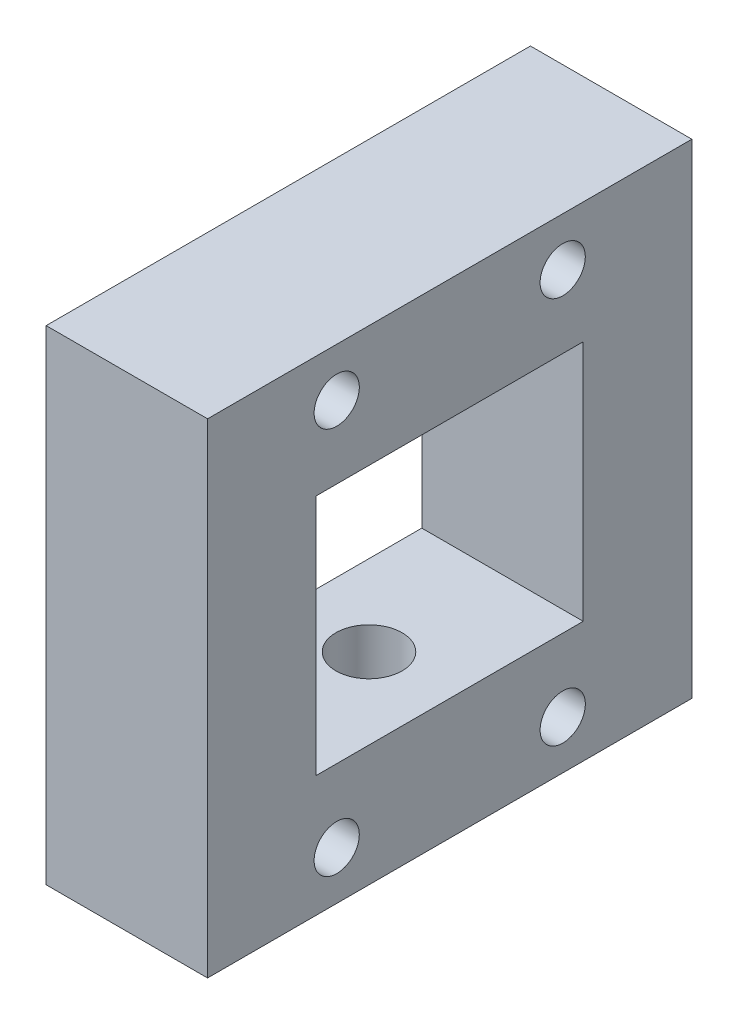
from build123d import *

# Parameters (mm, degrees)
SKETCH_1_W          = 30
SKETCH_1_H          = 30
SKETCH_1_W_2        = 16.540501684
SKETCH_1_H_2        = 15
EXTRUDE_1_DEPTH     = 10
SKETCH_4_R          = 1.4
CUT_EXTRUDE_3_DEPTH = 24.452078799
SKETCH_8_R          = 2.9
CUT_EXTRUDE_6_DEPTH = 2
CHAMFER_1_SIZE      = 2
CHAMFER_1_SIZE_2    = 1.6
SKETCH_5_R          = 2.05
CUT_EXTRUDE_7_DEPTH = 20
SKETCH_9_R          = 2.8
SKETCH_9_R_2        = 2.2
CUT_EXTRUDE_8_DEPTH = 5
FILLET_1_R          = 1


with BuildPart() as part:
    # 스케치1 → 보스-돌출1 (new body)
    with BuildSketch(Plane(origin=(0, 0, 0), x_dir=(0, 0, -1), z_dir=(1, 0, 0))):
        Rectangle(SKETCH_1_W, SKETCH_1_H)
        Rectangle(SKETCH_1_W_2, SKETCH_1_H_2, mode=Mode.SUBTRACT)
    extrude(amount=EXTRUDE_1_DEPTH)

    # 스케치4 → 컷-돌출3 (cut, through all)
    with BuildSketch(Plane(origin=(0, 0, 0), x_dir=(0, 0, -1), z_dir=(1, 0, 0))):
        with Locations((-7, -12)):
            Circle(SKETCH_4_R)
        with Locations(Location((-7, 12, 0), (0, 0, 180))):
            Circle(SKETCH_4_R)
        with Locations(Location((7, -12, 0), (0, 0, 180))):
            Circle(SKETCH_4_R)
        with Locations((7, 12)):
            Circle(SKETCH_4_R)
    extrude(amount=CUT_EXTRUDE_3_DEPTH, mode=Mode.SUBTRACT)

    # 스케치8 → 컷-돌출6 (cut)
    with BuildSketch(Plane.ZY):
        with Locations((-7, 12)):
            Circle(SKETCH_8_R)
        with Locations((7, 12)):
            Circle(SKETCH_8_R)
        with Locations((-7, -12)):
            Circle(SKETCH_8_R)
        with Locations((7, -12)):
            Circle(SKETCH_8_R)
    extrude(amount=-CUT_EXTRUDE_6_DEPTH, mode=Mode.SUBTRACT)

    # 모따기1
    # the kernel refuses this chamfer: 2, 1.6 mm, written as the material it adds along each edge
    with BuildSketch(Plane(origin=(2, -12, 7), x_dir=(0, 0, 1), z_dir=(0, -1, 0))) as chamfer_1_piece_1_section:
        Polygon((2.9, CHAMFER_1_SIZE), (2.9 - CHAMFER_1_SIZE_2, 0), (2.9, 0), align=None)
    chamfer_1_piece_1 = revolve(axis=Axis((2, -12, 7), (-1, 0, 0)), mode=Mode.PRIVATE)
    chamfer_1_piece_1 = split(chamfer_1_piece_1, bisect_by=Plane(origin=(0, -12, 4.826759692), z_dir=(1, 0, 0)), keep=Keep.TOP, mode=Mode.PRIVATE)
    chamfer_1_piece_1 = chamfer_1_piece_1 - Plane(origin=(0.956092246, -12, 7), x_dir=(0, 0, -1), z_dir=(-1, 0, 0)) * Cylinder(1.4, 12, mode=Mode.PRIVATE)
    add(chamfer_1_piece_1)
    with BuildSketch(Plane(origin=(2, 12, 7), x_dir=(0, 0, 1), z_dir=(0, -1, 0))) as chamfer_1_piece_2_section:
        Polygon((2.9, CHAMFER_1_SIZE), (2.9 - CHAMFER_1_SIZE_2, 0), (2.9, 0), align=None)
    chamfer_1_piece_2 = revolve(axis=Axis((2, 12, 7), (-1, 0, 0)), mode=Mode.PRIVATE)
    chamfer_1_piece_2 = split(chamfer_1_piece_2, bisect_by=Plane(origin=(0, 12, 4.826759692), z_dir=(1, 0, 0)), keep=Keep.TOP, mode=Mode.PRIVATE)
    chamfer_1_piece_2 = chamfer_1_piece_2 - Plane(origin=(0.956092246, 12, 7), x_dir=(0, 0, 1), z_dir=(-1, 0, 0)) * Cylinder(1.4, 12, mode=Mode.PRIVATE)
    add(chamfer_1_piece_2)
    with BuildSketch(Plane(origin=(2, 12, -7), x_dir=(0, 0, 1), z_dir=(0, -1, 0))) as chamfer_1_piece_3_section:
        Polygon((2.9, CHAMFER_1_SIZE), (2.9 - CHAMFER_1_SIZE_2, 0), (2.9, 0), align=None)
    chamfer_1_piece_3 = revolve(axis=Axis((2, 12, -7), (-1, 0, 0)), mode=Mode.PRIVATE)
    chamfer_1_piece_3 = split(chamfer_1_piece_3, bisect_by=Plane(origin=(0, 12, -9.173240308), z_dir=(1, 0, 0)), keep=Keep.TOP, mode=Mode.PRIVATE)
    chamfer_1_piece_3 = chamfer_1_piece_3 - Plane(origin=(0.956092246, 12, -7), x_dir=(0, 0, -1), z_dir=(-1, 0, 0)) * Cylinder(1.4, 12, mode=Mode.PRIVATE)
    add(chamfer_1_piece_3)
    with BuildSketch(Plane(origin=(2, -12, -7), x_dir=(0, 0, 1), z_dir=(0, -1, 0))) as chamfer_1_piece_4_section:
        Polygon((2.9, CHAMFER_1_SIZE), (2.9 - CHAMFER_1_SIZE_2, 0), (2.9, 0), align=None)
    chamfer_1_piece_4 = revolve(axis=Axis((2, -12, -7), (-1, 0, 0)), mode=Mode.PRIVATE)
    chamfer_1_piece_4 = split(chamfer_1_piece_4, bisect_by=Plane(origin=(0, -12, -9.173240308), z_dir=(1, 0, 0)), keep=Keep.TOP, mode=Mode.PRIVATE)
    chamfer_1_piece_4 = chamfer_1_piece_4 - Plane(origin=(0.956092246, -12, -7), x_dir=(0, 0, 1), z_dir=(-1, 0, 0)) * Cylinder(1.4, 12, mode=Mode.PRIVATE)
    add(chamfer_1_piece_4)

    # 스케치5 → 컷-돌출7 (cut)
    with BuildSketch(Plane(origin=(0, 0, 0), x_dir=(1, 0, 0), z_dir=(0, 1, 0))):
        with Locations(Location((5, 0, 0), (0, 0, 270))):
            Circle(SKETCH_5_R)
    extrude(amount=-CUT_EXTRUDE_7_DEPTH, mode=Mode.SUBTRACT)

    # 스케치9 → 컷-돌출8 (cut)
    with BuildSketch(Plane.XZ.offset(-7.5)):
        with Locations(Location((5, 0, 0), (0, 0, 270))):
            Circle(SKETCH_9_R)
        with Locations(Location((5, 0, 0), (0, 0, 270))):
            Circle(SKETCH_9_R_2, mode=Mode.SUBTRACT)
    extrude(amount=-CUT_EXTRUDE_8_DEPTH, mode=Mode.SUBTRACT)

    # 필렛1
    fillet_1_edges = [part.edges().sort_by_distance(p)[0] for p in [
        (5, 7.5, 2.2),
    ]]
    fillet(fillet_1_edges, radius=FILLET_1_R)


solid = part.part
